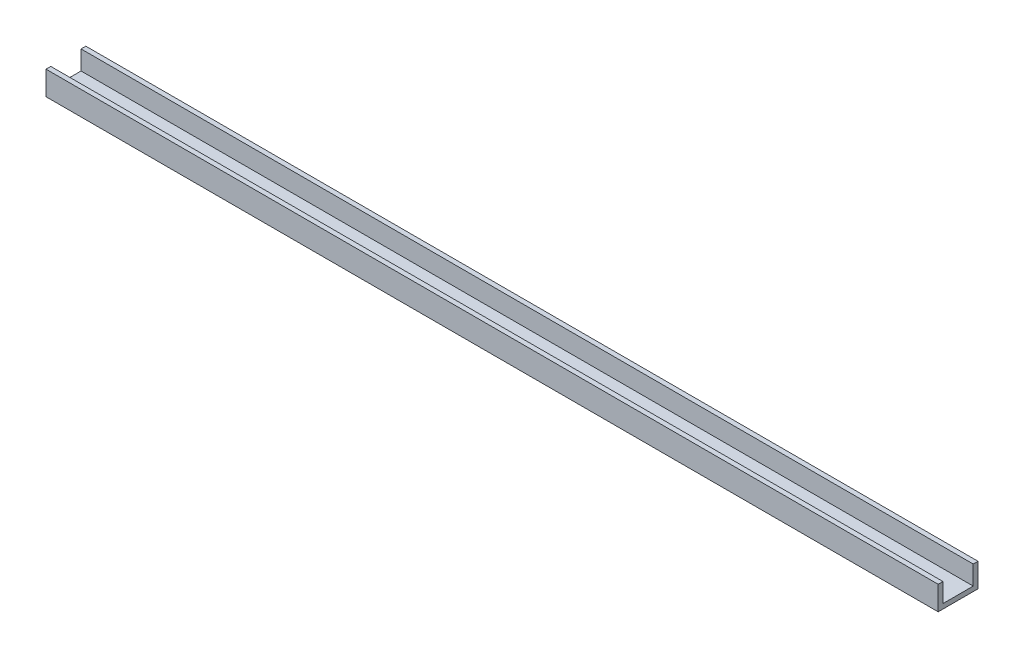
from build123d import *

# Parameters (mm, degrees)
EXTRUDE_1_DEPTH = 560


with BuildPart() as part:
    # Эскиз1 → Вытянуть-Тонкостенный1 (new body)
    with BuildSketch(Plane(origin=(0, 0, 0), x_dir=(0, 0, -1), z_dir=(1, 0, 0))):
        Polygon((-12.5, 15), (-12.5, 0), (12.5, 0), (12.5, 15), (9.5, 15), (9.5, 3), (-9.5, 3), (-9.5, 15), align=None)
    extrude(amount=EXTRUDE_1_DEPTH)


solid = part.part
